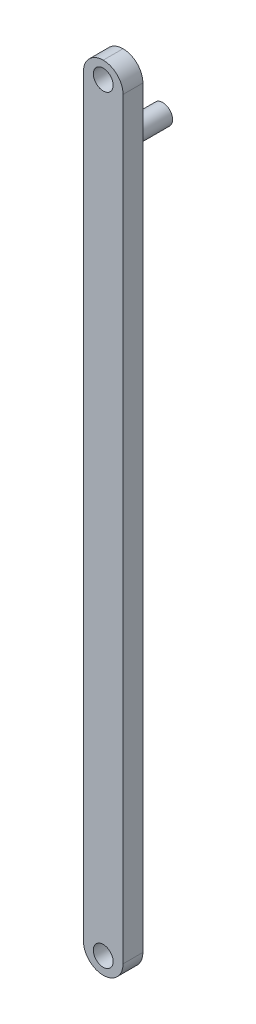
from build123d import *

# Parameters (mm, degrees)
SKETCH1_W           = 20
SKETCH1_H           = 400
BOSS_EXTRUDE1_DEPTH = 10
FILLET1_R           = 10
SKETCH2_R           = 5
CUT_EXTRUDE1_DEPTH  = 201.499376558
SKETCH3_R           = 5
BOSS_EXTRUDE2_DEPTH = 20
FILLET2_R           = 5


with BuildPart() as part:
    # Sketch1 → Boss-Extrude1 (new body)
    with BuildSketch(Plane.XY):
        Rectangle(SKETCH1_W, SKETCH1_H)
    extrude(amount=BOSS_EXTRUDE1_DEPTH)

    # Fillet1
    fillet1_edges = [part.edges().sort_by_distance(p)[0] for p in [
        (-10, -200, 5),
        (10, -200, 5),
        (-10, 200, 5),
        (10, 200, 5),
    ]]
    fillet(fillet1_edges, radius=FILLET1_R - 0.0001)  # a hair under: the kernel refuses the full size

    # Sketch2 → Cut-Extrude1 (cut, through all)
    with BuildSketch(Plane.XY.offset(10)):
        with Locations((0, 191.5)):
            Circle(SKETCH2_R)
    cut_extrude1 = extrude(amount=-CUT_EXTRUDE1_DEPTH, mode=Mode.SUBTRACT)

    # Mirror1: Cut-Extrude1 across plane
    add(cut_extrude1.mirror(Plane.ZX), mode=Mode.SUBTRACT)

    # Sketch3 → Boss-Extrude2 (add)
    with BuildSketch(Plane(origin=(0, 0, 0), x_dir=(-1, 0, 0), z_dir=(0, 0, -1))):
        with Locations((0, 161.5)):
            Circle(SKETCH3_R)
    extrude(amount=BOSS_EXTRUDE2_DEPTH)

    # Fillet2
    fillet2_edges = [part.edges().sort_by_distance(p)[0] for p in [
        (5, 161.5, 0),
    ]]
    fillet(fillet2_edges, radius=FILLET2_R - 0.0001)  # a hair under: the kernel refuses the full size


solid = part.part
